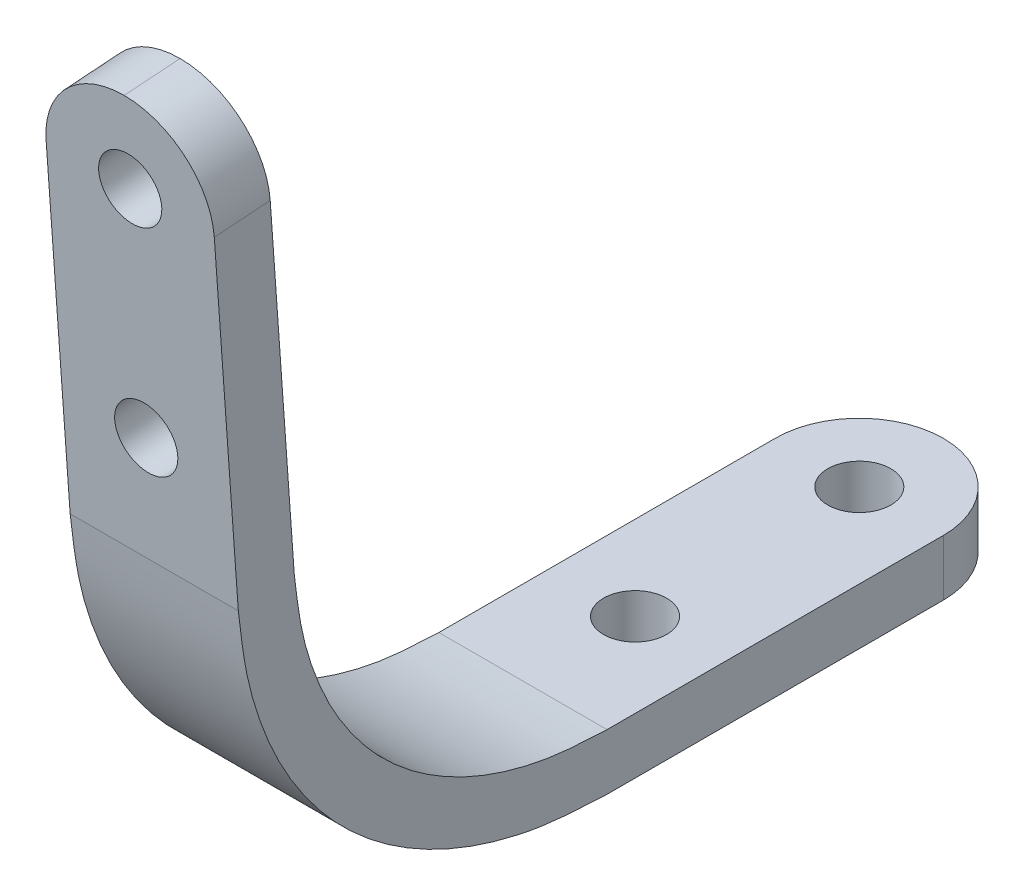
from build123d import *

# Parameters (mm, degrees)
SKETCH1_W                        = 25.4
SKETCH1_H                        = 152.4
BOSS_EXTRUDE1_DEPTH              = 6.35
BOSS_EXTRUDE2_DEPTH              = 6.35
MOVE_FACE2_BY                    = 50.8
MOVE_FACE2_2_BY                  = 50.8
MOVE_FACE3_BY                    = 3.175
MOVE_FACE3_2_BY                  = 3.175
MOVE_FACE3_3_BY                  = 3.175
MOVE_FACE3_4_BY                  = 3.175
MOVE_FACE4_BY                    = 53.975
MOVE_FACE4_2_BY                  = 53.975
FILLET1_R                        = 9.525
FILLET2_R                        = 9.525
SKETCH4_W                        = 3.57124
SKETCH4_H                        = 9.744385997
F_1_4_CLEARANCE_HOLE1_AT_2_COUNT = 2
F_1_4_CLEARANCE_HOLE1_AT_2_PITCH = 25.4
SKETCH6_W                        = 3.57124
SKETCH6_H                        = 6.35
F_1_4_CLEARANCE_HOLE2_AT_2_COUNT = 2
F_1_4_CLEARANCE_HOLE2_AT_2_PITCH = 25.4
LOFT3_START                      = -9.525
LOFT3_DEPTH                      = 19.05


# Read off the part's stored shape, not the designer's step: Loft3
with BuildPart() as part:
    # Sketch1 → Boss-Extrude1 (new body)
    with BuildSketch(Plane(origin=(0, 12.7, 0), x_dir=(1, 0, 0), z_dir=(0, 1, 0))):
        with Locations((0, 76.2)):
            Rectangle(SKETCH1_W, SKETCH1_H)
    extrude(amount=BOSS_EXTRUDE1_DEPTH)

    # Move Face2: a face moved inward by 50.8
    extrude(part.faces().sort_by_distance((0, 15.875, 0))[0], amount=MOVE_FACE2_BY, dir=(0, 0, -1), mode=Mode.SUBTRACT)

    # Move Face3 3: a face moved inward by 3.175
    extrude(part.faces().sort_by_distance((-12.7, 15.875, -101.6))[0], amount=MOVE_FACE3_3_BY, dir=(1, 0, 0), mode=Mode.SUBTRACT)

    # Move Face3 4: a face moved inward by 3.175
    extrude(part.faces().sort_by_distance((12.7, 15.875, -101.6))[0], amount=MOVE_FACE3_4_BY, dir=(-1, 0, 0), mode=Mode.SUBTRACT)

    # Move Face4: a face moved inward by 53.975
    extrude(part.faces().sort_by_distance((0, 15.875, -152.4))[0], amount=MOVE_FACE4_BY, dir=(0, 0, 1), mode=Mode.SUBTRACT)

    # Fillet1
    fillet1_edges = [part.edges().sort_by_distance(p)[0] for p in [
        (-9.525, 15.875, -98.425),
        (9.525, 15.875, -98.425),
    ]]
    fillet(fillet1_edges, radius=FILLET1_R - 0.0001)  # a hair under: the kernel refuses the full size

    # Sketch6 → 1/4 Clearance Hole2 (revolve, cut)
    with BuildSketch(Plane(origin=(0, 19.05, -88.9), x_dir=(0, 0, 1), z_dir=(1, 0, 0))):
        with Locations((1.78562, 3.175)):
            Rectangle(SKETCH6_W, SKETCH6_H)
    f_1_4_clearance_hole2 = revolve(axis=Axis((0, 25.4, -88.9), (0, -1, 0)), mode=Mode.SUBTRACT)

    # 1/4 Clearance Hole2 at 2: 1/4 Clearance Hole2 ×2
    with Locations(*[(0, 0, i * F_1_4_CLEARANCE_HOLE2_AT_2_PITCH) for i in range(1, F_1_4_CLEARANCE_HOLE2_AT_2_COUNT)]):
        add(f_1_4_clearance_hole2, mode=Mode.SUBTRACT)



with BuildPart() as body_2:
    # Sketch2 → Boss-Extrude2 (new body)
    with BuildSketch(Plane(origin=(0, 0.907489357, -12.667535793), x_dir=(-0.9999663661828886, -0.008180650604649193, -0.0005860534737717401), z_dir=(0, 0.07145585486812427, -0.9974437632293189))):
        Polygon((-12.699572851, -0.104160522), (12.699572851, 0.104160522), (11.449646591, 152.499034728), (-13.94949911, 152.290713685), align=None)
    extrude(amount=BOSS_EXTRUDE2_DEPTH)

    # Move Face2 2: a face moved inward by 50.8
    extrude(body_2.faces().sort_by_distance((0, 1.134361696, -15.834419741))[0], amount=MOVE_FACE2_2_BY, dir=(0, 0.997443763, 0.071455855), mode=Mode.SUBTRACT)

    # Move Face3: a face moved inward by 3.175
    extrude(body_2.faces().sort_by_distance((-12.7, 102.474648035, -8.574504887))[0], amount=MOVE_FACE3_BY, dir=(1, 0, 0), mode=Mode.SUBTRACT)

    # Move Face3 2: a face moved inward by 3.175
    extrude(body_2.faces().sort_by_distance((12.7, 102.474648034, -8.57450488))[0], amount=MOVE_FACE3_2_BY, dir=(-1, 0, 0), mode=Mode.SUBTRACT)

    # Move Face4 2: a face moved inward by 53.975
    extrude(body_2.faces().sort_by_distance((0, 153.144791212, -4.944547459))[0], amount=MOVE_FACE4_2_BY, dir=(0, -0.997443763, -0.071455855), mode=Mode.SUBTRACT)

    # Fillet2
    fillet2_edges = [body_2.edges().sort_by_distance(p)[0] for p in [
        (-9.525, 99.307764104, -8.801377233),
        (9.525, 99.307764104, -8.801377233),
    ]]
    fillet(fillet2_edges, radius=FILLET2_R - 0.0001)  # a hair under: the kernel refuses the full size

    # Sketch4 → 1/4 Clearance Hole1 (revolve, cut)
    with BuildSketch(Plane(origin=(0, 90.033984586, -12.648878192), x_dir=(0, 0.9974437632293188, 0.0714558548681243), z_dir=(1, 0, 0))):
        with Locations((1.78562, 4.872192999)):
            Rectangle(SKETCH4_W, SKETCH4_H)
    f_1_4_clearance_hole1 = revolve(axis=Axis((0, 90.487729265, -18.982646088), (0, -0.07145585486812432, 0.9974437632293189)), mode=Mode.SUBTRACT)

    # 1/4 Clearance Hole1 at 2: 1/4 Clearance Hole1 ×2
    with Locations(*[Vector(0, -0.9974437632293189, -0.07145585486812435) * (i * F_1_4_CLEARANCE_HOLE1_AT_2_PITCH) for i in range(1, F_1_4_CLEARANCE_HOLE1_AT_2_COUNT)]):
        add(f_1_4_clearance_hole1, mode=Mode.SUBTRACT)


with BuildPart() as part_1:
    add(part.part)

    add(body_2.part)  # Loft3 merges body 2
    # Loft3 outline → Loft3 (add)
    with BuildSketch(Plane.YZ.offset(LOFT3_START)):
        with BuildLine():
            Line((12.7, -50.8), (19.05, -50.8))
            add(Edge.make_bspline(
                [(19.05, -50.8), (19.16435268, -48.259721259), (19.284158209, -45.598310632), (20.238582708, -40.655609448), (21.024823924, -38.005383458), (22.939642286, -33.534393131), (24.353513847, -31.032022366), (27.149811394, -27.22135746), (29.091786193, -25.135284693), (32.692898237, -22.073840859), (35.08784289, -20.48477446), (39.410577778, -18.255373215), (41.997846475, -17.281766963), (46.859712096, -15.976596503), (49.505760894, -15.666924156), (52.031377207, -15.371346262)],
                knots=[0, 0, 0, 0, 0.140029847, 0.146707099, 0.280001513, 0.293357714, 0.420004816, 0.440027032, 0.559972964, 0.579995179, 0.706642278, 0.719998479, 0.853292801, 0.859970045, 1, 1, 1, 1], degree=3))
            Line((52.031377207, -15.371346262), (51.577632529, -9.037578366))
            add(Edge.make_bspline(
                [(12.7, -50.8), (12.830888275, -47.877576679), (12.96801789, -44.815799103), (14.079582644, -39.058308854), (15.004508645, -35.932692281), (17.276326756, -30.628183482), (18.955040536, -27.655251759), (22.295645605, -23.102155651), (24.636255449, -20.587868409), (28.939006909, -16.930457371), (31.784385095, -15.043601418), (36.91299788, -12.398553342), (39.964529797, -11.252648021), (45.627876029, -9.732516559), (48.672030222, -9.376955955), (51.577632529, -9.037578366)],
                knots=[0, 0, 0, 0, 0.140029847, 0.146707099, 0.280001513, 0.293357714, 0.420004816, 0.440027032, 0.559972964, 0.579995179, 0.706642278, 0.719998479, 0.853292801, 0.859970045, 1, 1, 1, 1], degree=3))
        make_face()
    extrude(amount=LOFT3_DEPTH)


solid = part_1.part
